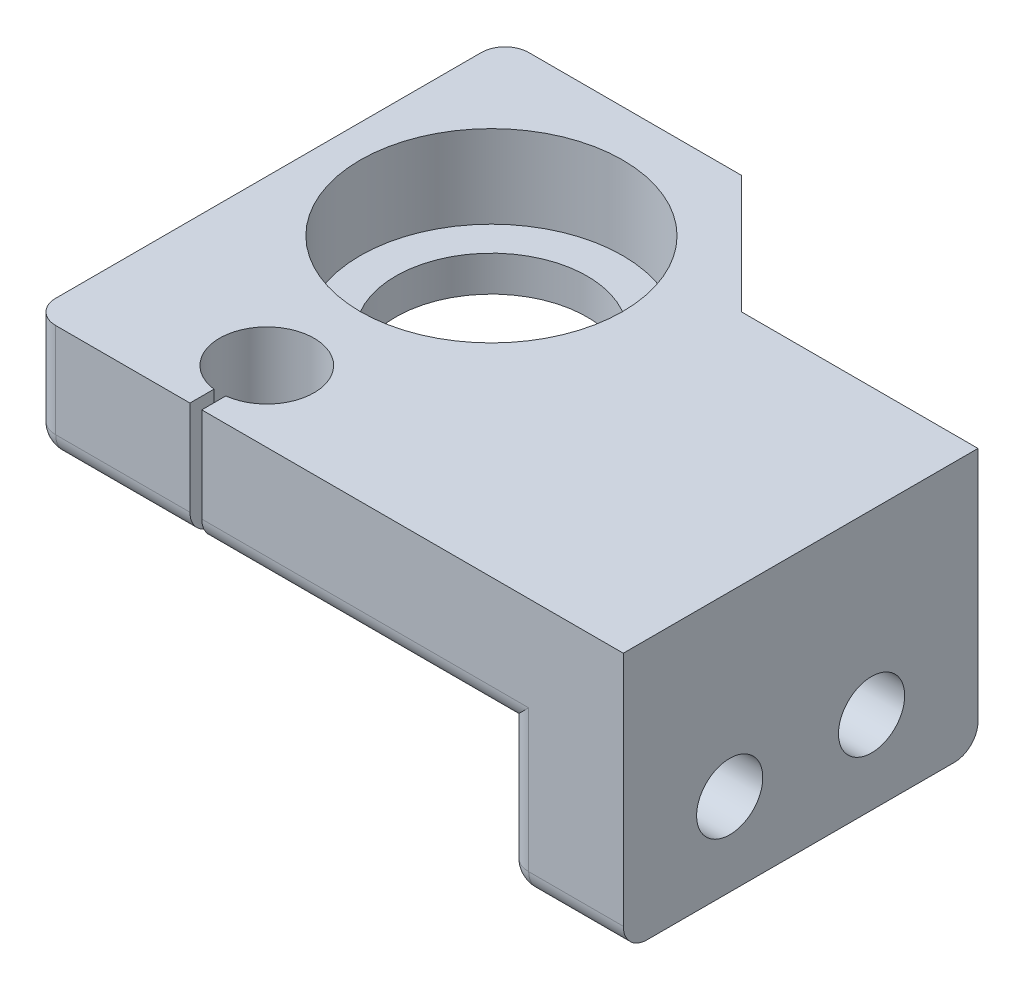
from build123d import *

# Parameters (mm, degrees)
SKETCH1_R           = 8.1
BOSS_EXTRUDE1_DEPTH = 10
SKETCH2_R           = 11.1
CUT_EXTRUDE1_DEPTH  = 7
SKETCH6_W           = 10
SKETCH6_H           = 12
BOSS_EXTRUDE3_DEPTH = 30
SKETCH7_R           = 2.8
CUT_EXTRUDE2_DEPTH  = 58.827329179
SKETCH8_R           = 4.3
CUT_EXTRUDE3_DEPTH  = 6
FILLET1_R           = 2
SKETCH9_W           = 20
SKETCH9_H           = 10
CUT_EXTRUDE4_DEPTH  = 66.1459899
CUT_EXTRUDE5_DEPTH  = 68.705243519


with BuildPart() as part:
    # Sketch1 → Boss-Extrude1 (new body)
    with BuildSketch(Plane(origin=(0, 0, 0), x_dir=(1, 0, 0), z_dir=(0, 1, 0))):
        with BuildLine():
            Line((50, 0), (0, 0))
            Line((0, 0), (0, -40))
            Line((0, -40), (13.35, -40))
            Line((13.35, -40), (13.35, -37.968626967))
            ThreePointArc((13.35, -37.968626967), (11.204248689, -31), (17.85, -34))
            ThreePointArc((17.85, -34), (16.85, -36.645751311), (14.35, -37.968626967))
            Line((14.35, -37.968626967), (14.35, -40))
            Line((14.35, -40), (50, -40))
            Line((50, -40), (50, 0))
        make_face()
        with Locations((13.85, -15)):
            Circle(SKETCH1_R, mode=Mode.SUBTRACT)
    extrude(amount=BOSS_EXTRUDE1_DEPTH)

    # Sketch2 → Cut-Extrude1 (cut)
    with BuildSketch(Plane(origin=(0, 10, 0), x_dir=(1, 0, 0), z_dir=(0, 1, 0))):
        with Locations((13.85, -15)):
            Circle(SKETCH2_R)
    extrude(amount=-CUT_EXTRUDE1_DEPTH, mode=Mode.SUBTRACT)

    # Sketch6 → Boss-Extrude3 (add)
    with BuildSketch(Plane.XY.offset(40)):
        with Locations((45, -6)):
            Rectangle(SKETCH6_W, SKETCH6_H)
    extrude(amount=-BOSS_EXTRUDE3_DEPTH)

    # Sketch7 → Cut-Extrude2 (cut, through all)
    with BuildSketch(Plane.ZY.offset(-40)):
        with Locations((19, -5)):
            Circle(SKETCH7_R)
        with Locations((31, -5)):
            Circle(SKETCH7_R)
    extrude(amount=-CUT_EXTRUDE2_DEPTH, mode=Mode.SUBTRACT)

    # Sketch8 → Cut-Extrude3 (cut)
    with BuildSketch(Plane.ZY.offset(-40)):
        with Locations((19, -5)):
            Circle(SKETCH8_R)
        with Locations((31, -5)):
            Circle(SKETCH8_R)
    extrude(amount=-CUT_EXTRUDE3_DEPTH, mode=Mode.SUBTRACT)

    # Fillet1
    fillet1_edges = [part.edges().sort_by_distance(p)[0] for p in [
        (45, -12, 10),
        (45, -12, 40),
        (6.675, 0, 40),
        (27.175, 0, 40),
        (40, -6, 40),
        (40, -12, 25),
        (40, -6, 10),
        (0, 5, 40),
        (0, 5, 0),
        (25, 0, 0),
        (0, 0, 20),
    ]]
    fillet(fillet1_edges, radius=FILLET1_R)

    # Sketch9 → Cut-Extrude4 (cut, through all)
    with BuildSketch(Plane.XZ):
        with Locations((40, 5)):
            Rectangle(SKETCH9_W, SKETCH9_H)
    extrude(amount=-CUT_EXTRUDE4_DEPTH, mode=Mode.SUBTRACT)

    # Sketch10 → Cut-Extrude5 (cut, through all)
    with BuildSketch(Plane(origin=(0, 10, 0), x_dir=(1, 0, 0), z_dir=(0, 1, 0))):
        Polygon((30, 0), (20, 0), (30, -10), align=None)
    extrude(amount=-CUT_EXTRUDE5_DEPTH, mode=Mode.SUBTRACT)


solid = part.part
